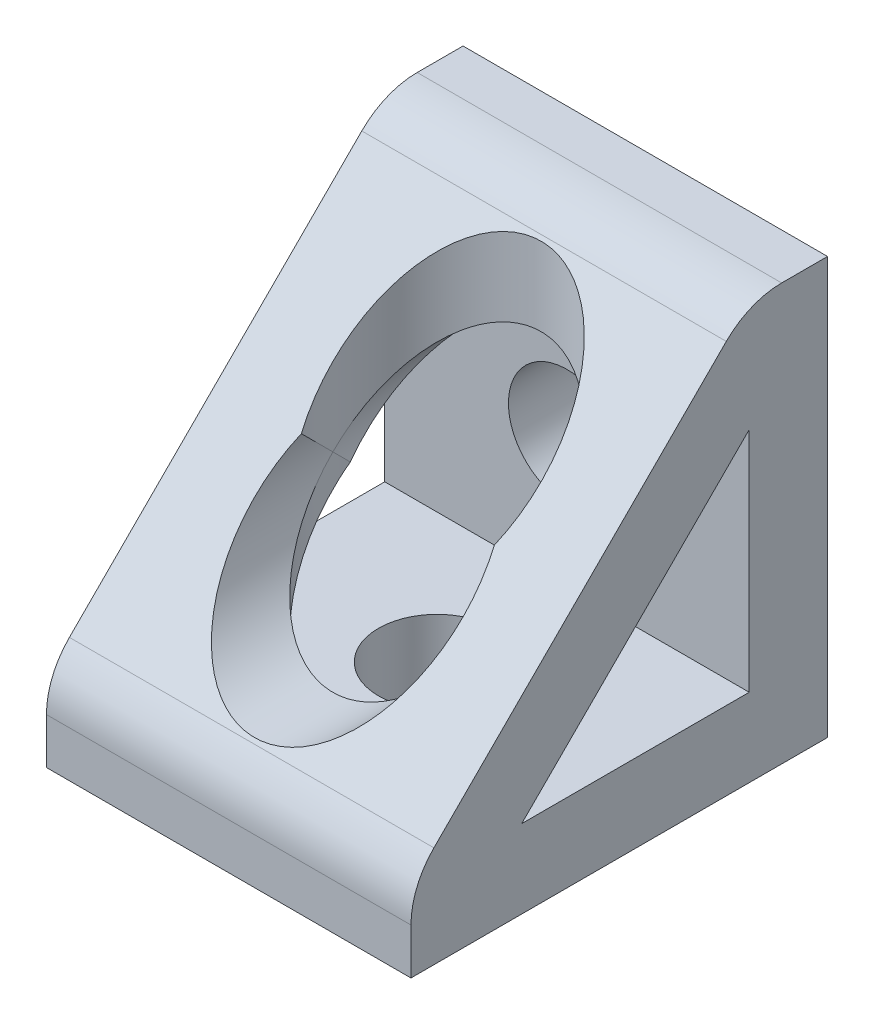
from build123d import *

# Parameters (mm, degrees)
BOSS_EXTRUDE1_START      = -11.1125
BOSS_EXTRUDE1_DEPTH      = 22.225
BOSS_EXTRUDE1_START_2    = 4.7752
BOSS_EXTRUDE1_2_DEPTH    = 20.6248
BOSS_EXTRUDE1_START_3    = 4
BOSS_EXTRUDE1_3_DEPTH    = 21.4
SKETCH2_W                = 22.225
SKETCH2_H                = 25.4
BOSS_EXTRUDE2_DEPTH      = 4.7752
K_0_281_DIAMETER_HOLE1_D = 7.1374
K_0_281_DIAMETER_HOLE2_D = 7.1374
FILLET1_R                = 4.7752


with BuildPart() as part:
    # Boss-Extrude1: read off the stored shape, not the designer's step
    # Boss-Extrude1 outline → Boss-Extrude1 (new body)
    with BuildSketch(Plane.YZ.offset(BOSS_EXTRUDE1_START)):
        Polygon((25.4, 4.7752), (4.7752, 25.4), (4.7752, 18.646847397), (18.646847397, 4.7752), (4.7752, 4.7752), (4.7752, 0), (25.4, 0), align=None)
    extrude(amount=BOSS_EXTRUDE1_DEPTH)

    # Boss-Extrude1 2 outline → Boss-Extrude1 2 (cut)
    with BuildSketch(Plane.XY.offset(BOSS_EXTRUDE1_START_2)):
        with BuildLine():
            ThreePointArc((6.272513521, 11.711023698), (0, 19.05), (-6.272513521, 11.711023698))
            ThreePointArc((-6.272513521, 11.711023698), (0, 6.35), (6.272513521, 11.711023698))
        make_face()
    extrude(amount=BOSS_EXTRUDE1_2_DEPTH, mode=Mode.SUBTRACT)

    # Boss-Extrude1 3 outline → Boss-Extrude1 3 (cut)
    with BuildSketch(Plane(origin=(0, 0, 0), x_dir=(1, 0, 0), z_dir=(0, 1, 0)).offset(BOSS_EXTRUDE1_START_3)):
        with BuildLine():
            ThreePointArc((-6.272513521, -11.711023698), (0, -19.05), (6.272513521, -11.711023698))
            ThreePointArc((6.272513521, -11.711023698), (0, -6.35), (-6.272513521, -11.711023698))
        make_face()
    extrude(amount=BOSS_EXTRUDE1_3_DEPTH, mode=Mode.SUBTRACT)

    # Sketch2 → Boss-Extrude2 (add)
    with BuildSketch(Plane.XZ.offset(-4.7752)):
        with Locations((0, 12.7)):
            Rectangle(SKETCH2_W, SKETCH2_H)
    extrude(amount=BOSS_EXTRUDE2_DEPTH)

    # K (0.281) Diameter Hole1 (through all)
    with Locations(Plane(origin=(0, 0, 0), x_dir=(-1, 0, 0), z_dir=(0, -1, 0))):
        with Locations((0, -12.7)):
            Hole(K_0_281_DIAMETER_HOLE1_D / 2)

    # K (0.281) Diameter Hole2 (through all)
    with Locations(Plane.XY.offset(4.7752)):
        with Locations((0, 12.7)):
            Hole(K_0_281_DIAMETER_HOLE2_D / 2)

    # Fillet1
    fillet1_edges = [part.edges().sort_by_distance(p)[0] for p in [
        (0, 25.4, 4.7752),
        (0, 4.7752, 25.4),
    ]]
    fillet(fillet1_edges, radius=FILLET1_R)


solid = part.part
